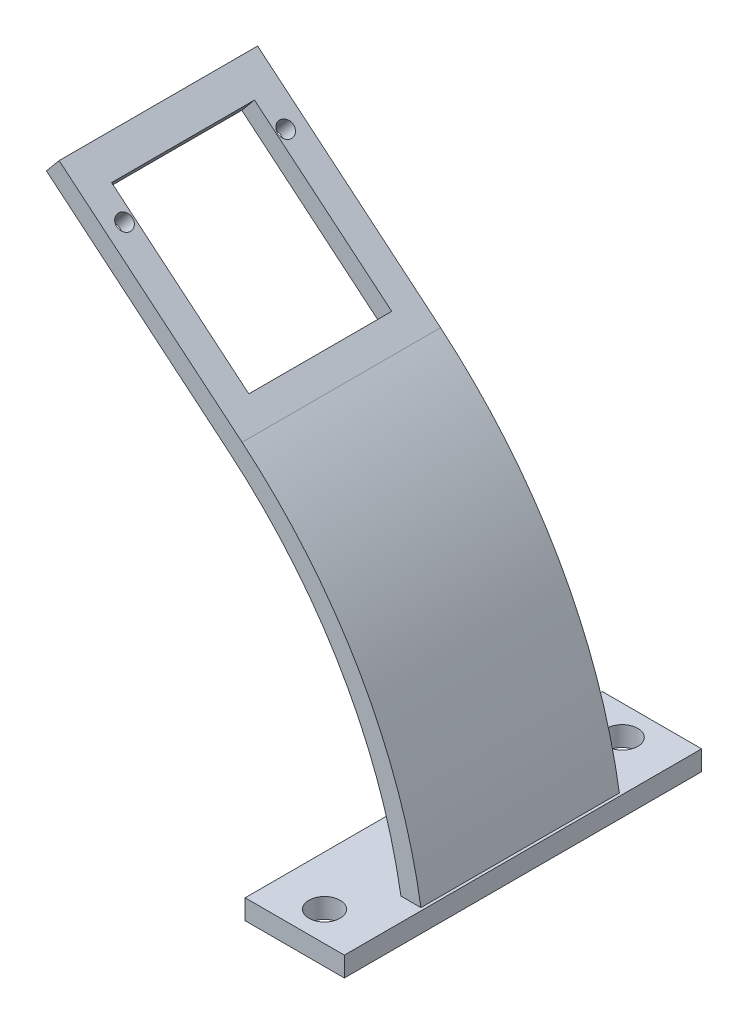
from build123d import *

# Parameters (mm, degrees)
BOSS_EXTRUDE1_DEPTH = 25.4
CUT_EXTRUDE1_REACH  = 81.149
SKETCH2_R           = 0.99949
SKETCH2_W           = 22.86
SKETCH2_H           = 18.288
SKETCH3_W           = 12.7
SKETCH3_H           = 45.72
SKETCH3_R           = 2
BOSS_EXTRUDE2_DEPTH = 2.54


with BuildPart() as part:
    # Sketch1 → Boss-Extrude1 (new body)
    with BuildSketch(Plane.XY):
        with BuildLine():
            Line((-22.332130244, 40.720807495), (-45.746440302, 60.234917377))
            Line((-45.746440302, 60.234917377), (-44.120264478, 62.186109882))
            Line((-44.120264478, 62.186109882), (-20.70595442, 42.672))
            ThreePointArc((-20.70595442, 42.672), (-5.010690915, 23.554414454), (2.54, 0))
            Line((2.54, 0), (0, 0))
            ThreePointArc((0, 0), (-7.309724658, 22.475300352), (-22.332130244, 40.720807495))
        make_face()
    extrude(amount=BOSS_EXTRUDE1_DEPTH)

    # Sketch2 → Cut-Extrude1 (cut, up to next)
    with BuildSketch(Plane(origin=(12.499484694, 14.997702276, 0), x_dir=(0.768186025531083, -0.6402267021756891, 0), z_dir=(0.6402267021756891, 0.768186025531083, 0)), mode=Mode.PRIVATE) as cut_extrude1_sk1:
        with Locations((-65.884565821, -2.416810605)):
            Circle(SKETCH2_R)
    cut_extrude1_tool1 = extrude(cut_extrude1_sk1.sketch, amount=-CUT_EXTRUDE1_REACH, mode=Mode.PRIVATE) & part.part
    # Sketch2 → Cut-Extrude1 (cut, up to next)
    with BuildSketch(Plane(origin=(12.499484694, 14.997702276, 0), x_dir=(0.768186025531083, -0.6402267021756891, 0), z_dir=(0.6402267021756891, 0.768186025531083, 0)), mode=Mode.PRIVATE) as cut_extrude1_sk2:
        with Locations((-65.889559314, -23.03399)):
            Circle(SKETCH2_R)
    cut_extrude1_tool2 = extrude(cut_extrude1_sk2.sketch, amount=-CUT_EXTRUDE1_REACH, mode=Mode.PRIVATE) & part.part
    # Sketch2 → Cut-Extrude1 (cut, up to next)
    with BuildSketch(Plane(origin=(12.499484694, 14.997702276, 0), x_dir=(0.768186025531083, -0.6402267021756891, 0), z_dir=(0.6402267021756891, 0.768186025531083, 0)), mode=Mode.PRIVATE) as cut_extrude1_sk3:
        with Locations((-58.160978666, -12.7)):
            Rectangle(SKETCH2_W, SKETCH2_H)
    cut_extrude1_tool3 = extrude(cut_extrude1_sk3.sketch, amount=-CUT_EXTRUDE1_REACH, mode=Mode.PRIVATE) & part.part
    add(cut_extrude1_tool1.solids().sort_by_distance((-38.112118, 57.178761, 2.416811))[0], mode=Mode.SUBTRACT)
    add(cut_extrude1_tool2.solids().sort_by_distance((-38.115954, 57.181958, 23.03399))[0], mode=Mode.SUBTRACT)
    add(cut_extrude1_tool3.solids().sort_by_distance((-32.178966, 52.233914, 12.7))[0], mode=Mode.SUBTRACT)

    # Sketch3 → Boss-Extrude2 (add)
    with BuildSketch(Plane(origin=(0, 0, 0), x_dir=(1, 0, 0), z_dir=(0, 1, 0))):
        with Locations((-3.81, -12.7)):
            Rectangle(SKETCH3_W, SKETCH3_H)
        with Locations((-3.81, 6.35)):
            Circle(SKETCH3_R, mode=Mode.SUBTRACT)
        with Locations((-3.81, -31.75)):
            Circle(SKETCH3_R, mode=Mode.SUBTRACT)
    extrude(amount=BOSS_EXTRUDE2_DEPTH)


solid = part.part
